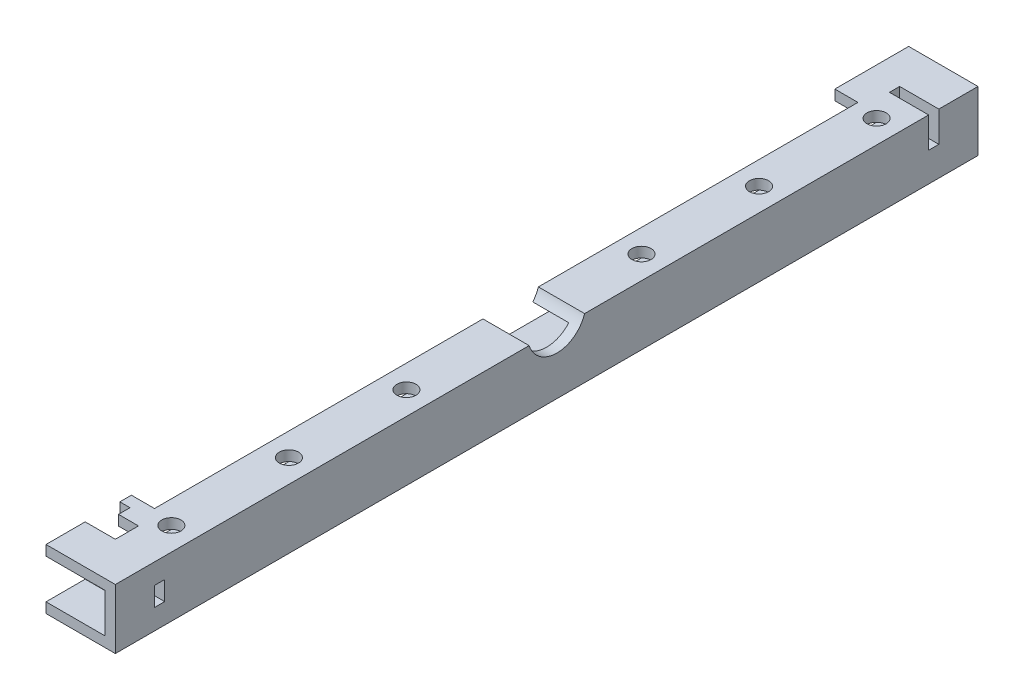
from build123d import *

# Parameters (mm, degrees)
EXTRUDE4_DEPTH     = 139.83
SKETCH2_W          = 6.35
SKETCH2_H          = 1.65
CUT_EXTRUDE2_DEPTH = 4.95
SKETCH4_R          = 1.55
SKETCH4_W          = 3.75
SKETCH4_H          = 114.02
CUT_EXTRUDE3_DEPTH = 1.65
CUT_EXTRUDE4_DEPTH = 1.65
SKETCH6_W          = 1.65
SKETCH6_H          = 3.1
CUT_EXTRUDE5_DEPTH = 1.65
SKETCH7_R          = 4.71
CUT_EXTRUDE6_DEPTH = 141.615989489


with BuildPart() as part:
    # Sketch1 → Extrude4 (new body)
    with BuildSketch(Plane.XY):
        Polygon((0, 0), (11.24, 0), (11.24, 9.7), (0, 9.7), (0, 8.05), (9.59, 8.05), (9.59, 1.65), (0, 1.65), align=None)
    extrude(amount=EXTRUDE4_DEPTH)

    # Sketch2 → Cut-Extrude2 (cut)
    with BuildSketch(Plane(origin=(0, 9.7, 0), x_dir=(-1, 0, 0), z_dir=(0, 1, 0))):
        with Locations((-8.065, 7.175)):
            Rectangle(SKETCH2_W, SKETCH2_H)
    extrude(amount=-CUT_EXTRUDE2_DEPTH, mode=Mode.SUBTRACT)

    # Sketch4 → Cut-Extrude3 (cut)
    with BuildSketch(Plane(origin=(0, 9.7, 0), x_dir=(-1, 0, 0), z_dir=(0, 1, 0))):
        with Locations((-7.495, 127)):
            Circle(SKETCH4_R)
        with Locations((-7.495, 12.7)):
            Circle(SKETCH4_R)
        with Locations((-7.495, 88.9)):
            Circle(SKETCH4_R)
        with Locations((-7.495, 107.95)):
            Circle(SKETCH4_R)
        with Locations((-7.495, 50.8)):
            Circle(SKETCH4_R)
        with Locations((-7.495, 31.75)):
            Circle(SKETCH4_R)
        with Locations((-1.875, 68.98)):
            Rectangle(SKETCH4_W, SKETCH4_H)
        Polygon((0, 133.48), (-4.89, 133.48), (-4.89, 129.73), (-1.65, 129.73), (-1.65, 127.86), (0, 127.86), align=None)
    extrude(amount=-CUT_EXTRUDE3_DEPTH, mode=Mode.SUBTRACT)

    # Sketch5 → Cut-Extrude4 (cut)
    with BuildSketch(Plane.XZ):
        Polygon((0, 133.475), (4.92, 133.475), (4.92, 129.725), (2.04, 129.725), (2.04, 127.855), (0, 127.855), align=None)
        Polygon((0, 6.35), (4.95, 6.35), (4.95, 8), (3.3, 8), (3.3, 11.24), (1.65, 11.24), (1.65, 8), (0, 8), align=None)
    extrude(amount=-CUT_EXTRUDE4_DEPTH, mode=Mode.SUBTRACT)

    # Sketch6 → Cut-Extrude5 (cut)
    with BuildSketch(Plane(origin=(11.24, 0, 0), x_dir=(0, 0, -1), z_dir=(1, 0, 0))):
        with Locations((-132.655, 4.85)):
            Rectangle(SKETCH6_W, SKETCH6_H)
    extrude(amount=-CUT_EXTRUDE5_DEPTH, mode=Mode.SUBTRACT)

    # Sketch7 → Cut-Extrude6 (cut, through all)
    with BuildSketch(Plane(origin=(11.24, 0, 0), x_dir=(0, 0, -1), z_dir=(1, 0, 0))):
        with Locations((-68.2625, 11.1125)):
            Circle(SKETCH7_R)
    extrude(amount=-CUT_EXTRUDE6_DEPTH, mode=Mode.SUBTRACT)


solid = part.part
